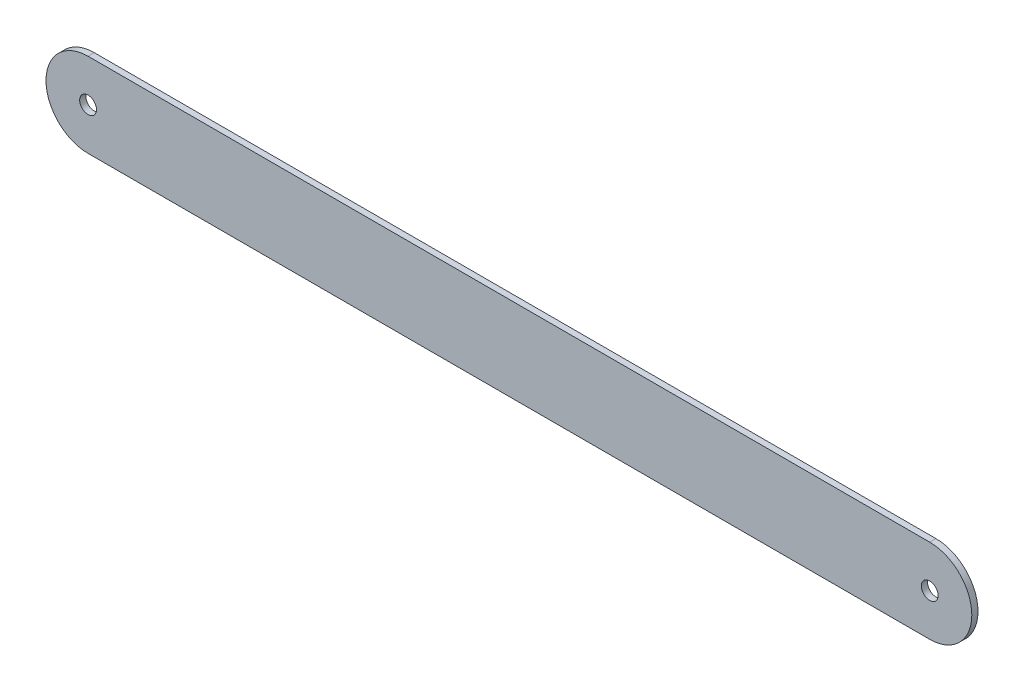
from build123d import *

# Parameters (mm, degrees)
SKETCH1_R          = 1
BASE_FLANGE1_DEPTH = 0.7366


# Sheet-metal steps are written as plain solids
with BuildPart() as part:
    # Sketch1 → Base-Flange1 (new body)
    with BuildSketch(Plane.XY):
        with BuildLine():
            Line((-28.344481605, 5), (71.655518395, 5))
            ThreePointArc((71.655518395, 5), (76.655518395, 0), (71.655518395, -5))
            Line((71.655518395, -5), (-28.344481605, -5))
            ThreePointArc((-28.344481605, -5), (-33.344481605, 0), (-28.344481605, 5))
        make_face()
        with Locations((-28.344481605, 0)):
            Circle(SKETCH1_R, mode=Mode.SUBTRACT)
        with Locations((71.655518395, 0)):
            Circle(SKETCH1_R, mode=Mode.SUBTRACT)
    extrude(amount=-BASE_FLANGE1_DEPTH)


solid = part.part
